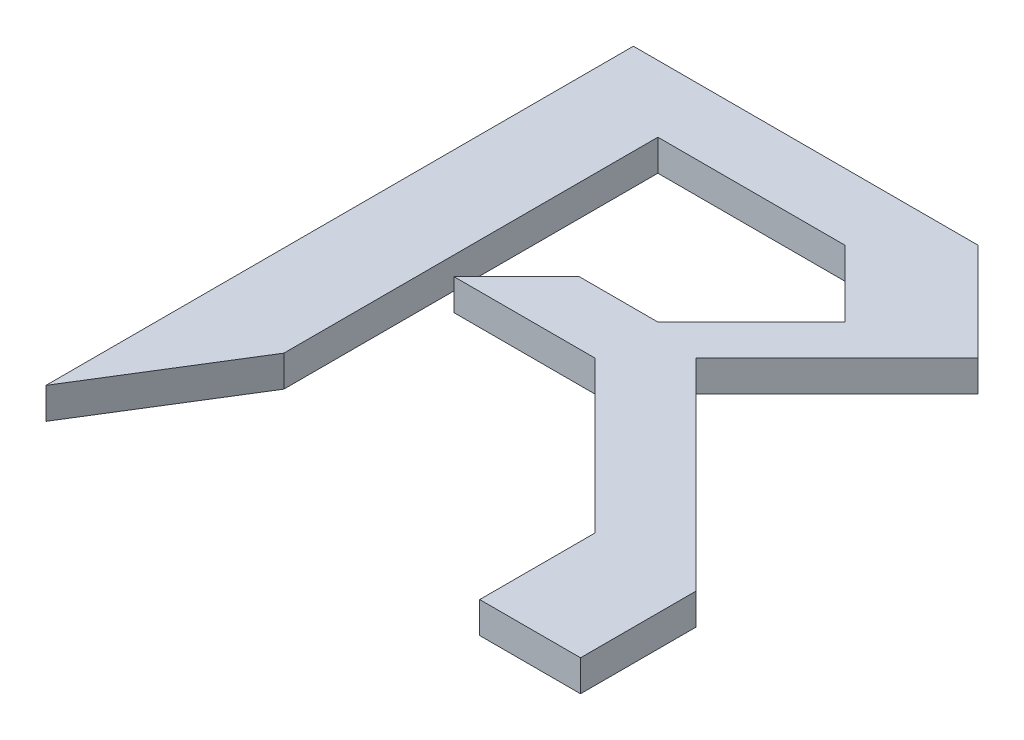
from build123d import *

# Parameters (mm, degrees)
BOSS_EXTRUDE1_DEPTH = 10


with BuildPart() as part:
    # Sketch1 → Boss-Extrude1 (new body)
    with BuildSketch(Plane(origin=(0, 0, 0), x_dir=(1, 0, 0), z_dir=(0, 1, 0))):
        Polygon((-339.915494315, 126.117456073), (-339.915494315, 314.332987561), (-229.495715842, 314.332987561), (-198.126460594, 282.963732313), (-243.298188151, 237.792004756), (-178.67752234, 173.171338945), (-178.67752234, 136.155617753), (-210.987855246, 136.155617753), (-210.987855246, 173.171338945), (-259.453354604, 221.636838303), (-304.781928437, 221.636838303), (-284.705605078, 241.713161662), (-259.453354604, 241.713161662), (-229.495715842, 271.670800424), (-250.826809411, 293.001893993), (-310.742086934, 293.001893993), (-310.742086934, 173.171338945), align=None)
    extrude(amount=BOSS_EXTRUDE1_DEPTH)


solid = part.part
